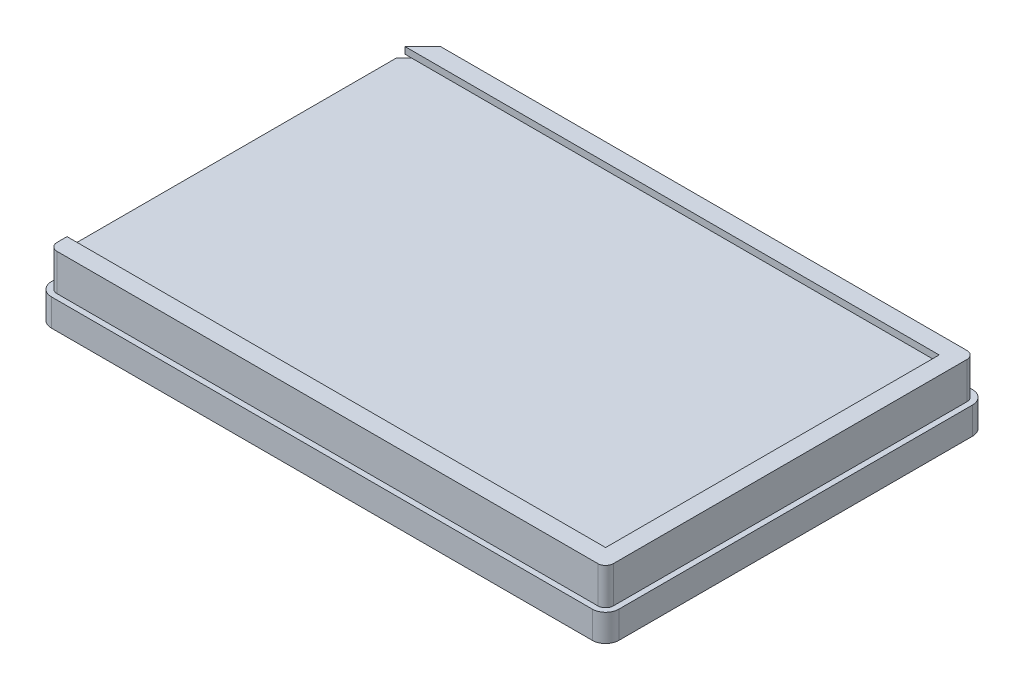
from build123d import *

# Parameters (mm, degrees)
SKETCH1_W           = 127.75
SKETCH1_H           = 85.6
BOSS_EXTRUDE1_DEPTH = 14.35
FILLET1_R           = 3
CUT_FLANGE_DEPTH    = 8.25
SKETCH5_W           = 80.1
SKETCH5_H           = 0.75
CUT_PAPERSLOT_DEPTH = 123.75
CUT_OPENTOP_REACH   = 80.216
SHELL1_DEPTH        = 11.1
SHELL1_2_DEPTH      = 5.1


# Read off the part's stored shape, not the designer's step: Shell1
with BuildPart() as part:
    # Sketch1 → Boss-Extrude1 (new body)
    with BuildSketch(Plane(origin=(0, 0, 0), x_dir=(1, 0, 0), z_dir=(0, 1, 0))):
        Rectangle(SKETCH1_W, SKETCH1_H)
    extrude(amount=BOSS_EXTRUDE1_DEPTH)

    # Fillet1
    fillet1_edges = [part.edges().sort_by_distance(p)[0] for p in [
        (-63.875, 7.175, -42.8),
        (63.875, 7.175, -42.8),
        (63.875, 7.175, 42.8),
        (-63.875, 7.175, 42.8),
    ]]
    fillet(fillet1_edges, radius=FILLET1_R)

    # Sketch3 → Cut-Flange (cut)
    with BuildSketch(Plane(origin=(0, 14.35, 0), x_dir=(1, 0, 0), z_dir=(0, 1, 0))):
        with BuildLine():
            Line((-63.875, 39.8), (-63.875, -39.8))
            ThreePointArc((-63.875, -39.8), (-62.996320344, -41.921320344), (-60.875, -42.8))
            Line((-60.875, -42.8), (60.875, -42.8))
            ThreePointArc((60.875, -42.8), (62.996320344, -41.921320344), (63.875, -39.8))
            Line((63.875, -39.8), (63.875, 39.8))
            ThreePointArc((63.875, 39.8), (62.996320344, 41.921320344), (60.875, 42.8))
            Line((60.875, 42.8), (-60.875, 42.8))
            ThreePointArc((-60.875, 42.8), (-62.996320344, 41.921320344), (-63.875, 39.8))
        make_face()
        with BuildLine():
            Line((-62.625, 36.600252532), (-62.625, -39.8))
            ThreePointArc((-62.625, -39.8), (-62.112436867, -41.037436867), (-60.875, -41.55))
            Line((-60.875, -41.55), (60.875, -41.55))
            ThreePointArc((60.875, -41.55), (62.112436867, -41.037436867), (62.625, -39.8))
            Line((62.625, -39.8), (62.625, 39.8))
            ThreePointArc((62.625, 39.8), (62.112436867, 41.037436867), (60.875, 41.55))
            Line((60.875, 41.55), (-57.675252532, 41.55))
            Line((-57.675252532, 41.55), (-62.625, 36.600252532))
        make_face(mode=Mode.SUBTRACT)
    extrude(amount=-CUT_FLANGE_DEPTH, mode=Mode.SUBTRACT)

    # Sketch5 → Cut-PaperSlot (cut)
    with BuildSketch(Plane.ZY.offset(62.625)):
        with Locations((0, 12.475)):
            Rectangle(SKETCH5_W, SKETCH5_H)
    extrude(amount=-CUT_PAPERSLOT_DEPTH, mode=Mode.SUBTRACT)

    # Sketch6 → Cut-OpenTop (cut, up to next)
    with BuildSketch(Plane(origin=(0, 14.35, 0), x_dir=(1, 0, 0), z_dir=(0, 1, 0)), mode=Mode.PRIVATE) as cut_opentop_sk1:
        Polygon((-57.675252532, 37.55), (-61.675252532, 37.55), (-62.625, 36.600252532), (-62.625, -37.55), (-60.875, -37.55), (58.625, -37.55), (58.625, 37.55), align=None)
    cut_opentop_tool1 = extrude(cut_opentop_sk1.sketch, amount=-CUT_OPENTOP_REACH, mode=Mode.PRIVATE) & part.part
    add(cut_opentop_tool1.solids().sort_by_distance((-1.997013, 14.35, 0.001844))[0], mode=Mode.SUBTRACT)

    # Shell1 outline → Shell1 (cut)
    with BuildSketch(Plane(origin=(0, 0, 0), x_dir=(1, 0, 0), z_dir=(0, 1, 0))):
        with BuildLine():
            Line((-61.625, 36.186038969), (-61.625, -39.8))
            ThreePointArc((-61.625, -39.8), (-61.405330086, -40.330330086), (-60.875, -40.55))
            Line((-60.875, -40.55), (60.875, -40.55))
            ThreePointArc((60.875, -40.55), (61.405330086, -40.330330086), (61.625, -39.8))
            Line((61.625, -39.8), (61.625, 39.8))
            ThreePointArc((61.625, 39.8), (61.405330086, 40.330330086), (60.875, 40.55))
            Line((60.875, 40.55), (-57.261038969, 40.55))
            Line((-57.261038969, 40.55), (-61.625, 36.186038969))
        make_face()
    extrude(amount=SHELL1_DEPTH, mode=Mode.SUBTRACT)

    # Shell1 2 outline → Shell1 2 (cut)
    with BuildSketch(Plane(origin=(0, 0, 0), x_dir=(1, 0, 0), z_dir=(0, 1, 0))):
        with BuildLine():
            Line((-62.875, 39.8), (-62.875, -39.8))
            ThreePointArc((-62.875, -39.8), (-62.289213562, -41.214213562), (-60.875, -41.8))
            Line((-60.875, -41.8), (60.875, -41.8))
            ThreePointArc((60.875, -41.8), (62.289213562, -41.214213562), (62.875, -39.8))
            Line((62.875, -39.8), (62.875, 39.8))
            ThreePointArc((62.875, 39.8), (62.289213562, 41.214213562), (60.875, 41.8))
            Line((60.875, 41.8), (-60.875, 41.8))
            ThreePointArc((-60.875, 41.8), (-62.289213562, 41.214213562), (-62.875, 39.8))
        make_face()
        with BuildLine():
            ThreePointArc((-60.875, -40.55), (-61.405330086, -40.330330086), (-61.625, -39.8))
            Line((-61.625, -39.8), (-61.625, 36.186038969))
            Line((-61.625, 36.186038969), (-57.261038969, 40.55))
            Line((-57.261038969, 40.55), (60.875, 40.55))
            ThreePointArc((60.875, 40.55), (61.405330086, 40.330330086), (61.625, 39.8))
            Line((61.625, 39.8), (61.625, -39.8))
            ThreePointArc((61.625, -39.8), (61.405330086, -40.330330086), (60.875, -40.55))
            Line((60.875, -40.55), (-60.875, -40.55))
        make_face(mode=Mode.SUBTRACT)
    extrude(amount=SHELL1_2_DEPTH, mode=Mode.SUBTRACT)


solid = part.part
